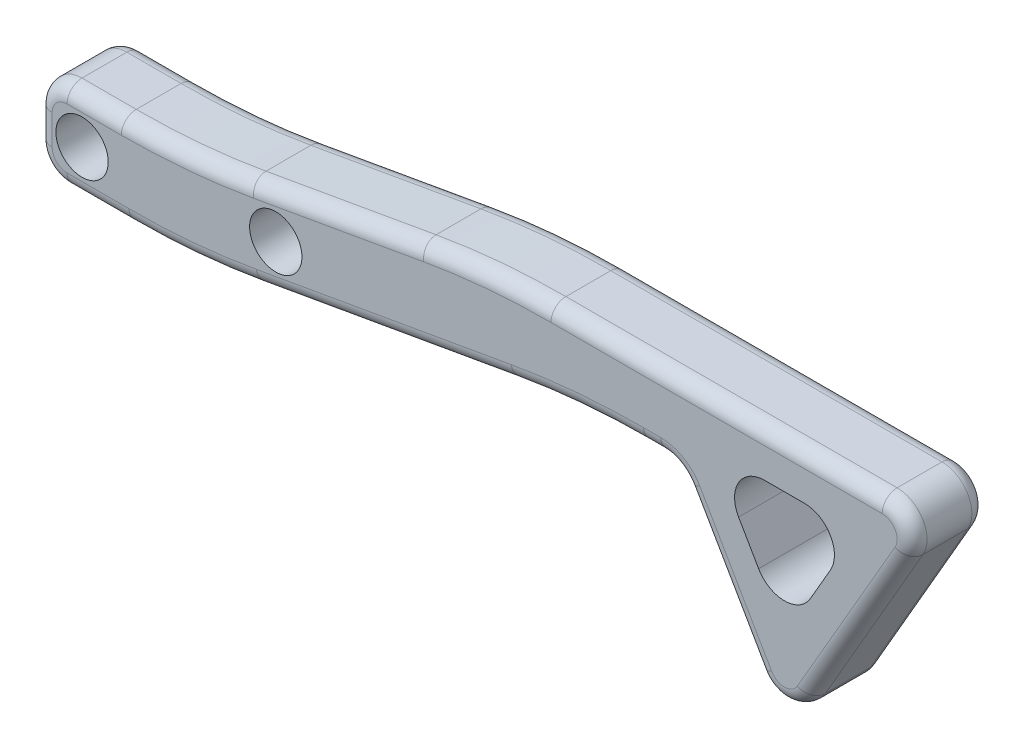
from build123d import *

# Parameters (mm, degrees)
BOSS_EXTRUDE1_DEPTH = 5
FILLET1_R           = 1
SKETCH2_R           = 1.75
CUT_EXTRUDE1_DEPTH  = 35.054632191


with BuildPart() as part:
    # Sketch1 → Boss-Extrude1 (new body)
    with BuildSketch(Plane.XY):
        with BuildLine():
            Line((4.374433176, 0), (26.535898385, 0))
            ThreePointArc((26.535898385, 0), (28.267949192, -1), (28.267949192, -3))
            Line((28.267949192, -3), (21.732050808, -14.320508076))
            ThreePointArc((21.732050808, -14.320508076), (20, -15.320508076), (18.267949192, -14.320508076))
            Line((18.267949192, -14.320508076), (13.464101615, -6))
            ThreePointArc((13.464101615, -6), (12.732050808, -5.267949192), (11.732050808, -5))
            Line((11.732050808, -5), (10.570646977, -5))
            ThreePointArc((10.570646977, -5), (6.21285984, -5.190265095), (1.888238094, -5.759612349))
            Line((1.888238094, -5.759612349), (-15.167092312, -8.766927265))
            ThreePointArc((-15.167092312, -8.766927265), (-19.491714058, -9.336274519), (-23.849501195, -9.526539614))
            Line((-23.849501195, -9.526539614), (-28, -9.526539614))
            ThreePointArc((-28, -9.526539614), (-29.414213562, -8.940753177), (-30, -7.526539614))
            Line((-30, -7.526539614), (-30, -5.526539614))
            ThreePointArc((-30, -5.526539614), (-29.414213562, -4.112326052), (-28, -3.526539614))
            Line((-28, -3.526539614), (-24.374433176, -3.526539614))
            ThreePointArc((-24.374433176, -3.526539614), (-20.016646039, -3.336274519), (-15.692024293, -2.766927265))
            Line((-15.692024293, -2.766927265), (-4.307975707, -0.759612349))
            ThreePointArc((-4.307975707, -0.759612349), (0.016646039, -0.190265095), (4.374433176, 0))
        make_face()
        with BuildLine():
            Line((21.732050808, -8.320508076), (23.07179677, -6))
            ThreePointArc((23.07179677, -6), (23.07179677, -4), (21.339745962, -3))
            Line((21.339745962, -3), (18.660254038, -3))
            ThreePointArc((18.660254038, -3), (16.92820323, -4), (16.92820323, -6))
            Line((16.92820323, -6), (18.267949192, -8.320508076))
            ThreePointArc((18.267949192, -8.320508076), (20, -9.320508076), (21.732050808, -8.320508076))
        make_face(mode=Mode.SUBTRACT)
    extrude(amount=BOSS_EXTRUDE1_DEPTH)

    # Fillet1
    fillet1_edges = [part.edges().sort_by_distance(p)[0] for p in [
        (0.016646039, -0.190265095, 0),
        (15.455165781, 0, 0),
        (28.267949192, -1, 0),
        (25, -8.660254038, 0),
        (20, -15.320508076, 0),
        (15.866025404, -10.160254038, 0),
        (12.732050808, -5.267949192, 0),
        (11.151348892, -5, 0),
        (6.21285984, -5.190265095, 0),
        (-6.639427109, -7.263269807, 0),
        (-19.491714058, -9.336274519, 0),
        (-25.924750598, -9.526539614, 0),
        (-29.414213562, -8.940753177, 0),
        (-30, -6.526539614, 0),
        (-29.414213562, -4.112326052, 0),
        (-26.187216588, -3.526539614, 0),
        (-20.016646039, -3.336274519, 0),
        (-10, -1.763269807, 5),
        (0.016646039, -0.190265095, 5),
        (15.455165781, 0, 5),
        (28.267949192, -1, 5),
        (25, -8.660254038, 5),
        (20, -15.320508076, 5),
        (15.866025404, -10.160254038, 5),
        (12.732050808, -5.267949192, 5),
        (11.151348892, -5, 5),
        (6.21285984, -5.190265095, 5),
        (-6.639427109, -7.263269807, 5),
        (-19.491714058, -9.336274519, 5),
        (-25.924750598, -9.526539614, 5),
        (-29.414213562, -8.940753177, 5),
        (-30, -6.526539614, 5),
        (-29.414213562, -4.112326052, 5),
        (-26.187216588, -3.526539614, 5),
        (-10, -1.763269807, 0),
        (-20.016646039, -3.336274519, 5),
    ]]
    fillet(fillet1_edges, radius=FILLET1_R)

    # Sketch2 → Cut-Extrude1 (cut, through all)
    with BuildSketch(Plane.XY.offset(5)):
        with Locations((-14.03773973, -5.536686745)):
            Circle(SKETCH2_R)
        with Locations((-27, -6.526539614)):
            Circle(SKETCH2_R)
    extrude(amount=-CUT_EXTRUDE1_DEPTH, mode=Mode.SUBTRACT)


solid = part.part
